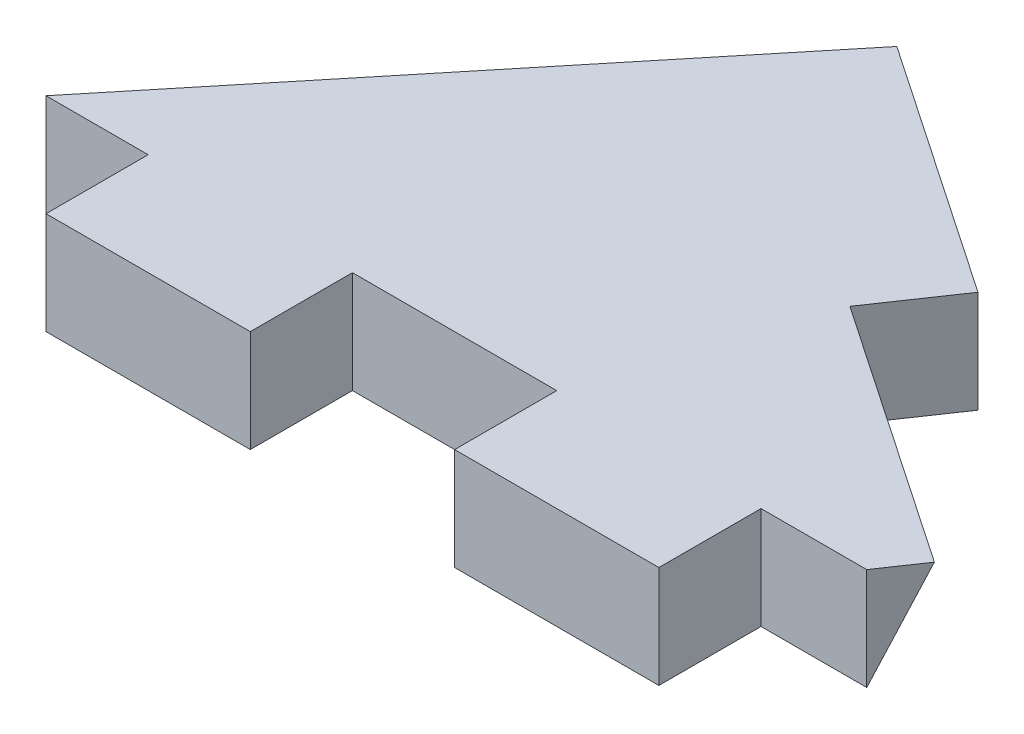
from build123d import *

# Parameters (mm, degrees)
BOSS_EXTRUDE1_DEPTH = 10
BOSS_EXTRUDE2_START = 29.60383513
BOSS_EXTRUDE2_DEPTH = 31.225392193


# Read off the part's stored shape, not the designer's step: Boss-Extrude2
with BuildPart() as part:
    # Sketch1 → Boss-Extrude1 (new body)
    with BuildSketch(Plane(origin=(0, 0, 0), x_dir=(1, 0, 0), z_dir=(0, 1, 0))):
        Polygon((10, 0), (10, 10), (0, 10), (37.469962049, 55.82661754), (62.28046579, 38.961300937), (54.526318582, 27.55420418), (80.350242243, 10), (70, 10), (70, 0), (50, 0), (50, 10), (30, 10), (30, 0), align=None)
    extrude(amount=BOSS_EXTRUDE1_DEPTH)

    # Boss-Extrude2 outline → Boss-Extrude2 (add)
    with BuildSketch(Plane(origin=(0, 0, 0), x_dir=(0.562177220107601, 0, -0.8270167913604233), z_dir=(0.8270167913604233, 0, 0.5621772201076011)).offset(BOSS_EXTRUDE2_START)):
        Polygon((53.441243733, 0), (58.207083275, 10), (53.441243733, 10), align=None)
    extrude(amount=BOSS_EXTRUDE2_DEPTH)


solid = part.part
